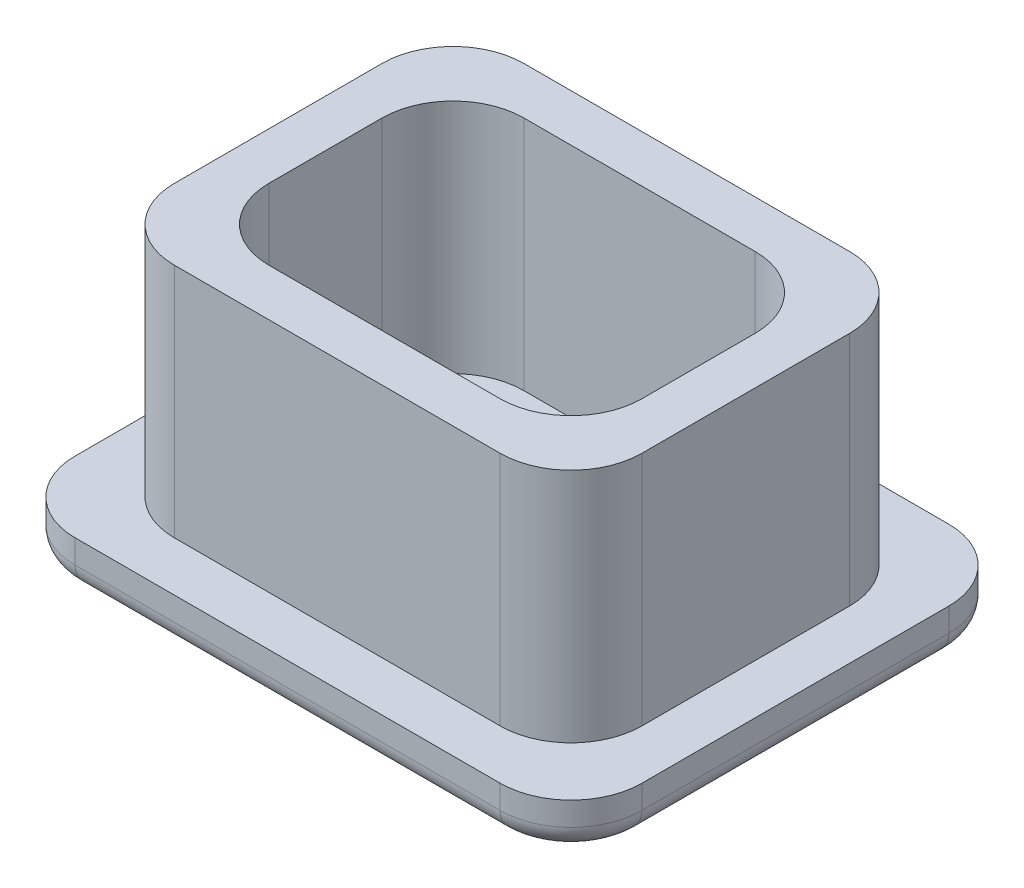
from build123d import *

# Parameters (mm, degrees)
SKETCH1_W           = 24
SKETCH1_H           = 19
BOSS_EXTRUDE1_DEPTH = 2
FILLET1_R           = 3
FILLET2_R           = 1
SKETCH2_W           = 19.8
SKETCH2_H           = 14.8
SKETCH2_W_2         = 15.8
SKETCH2_H_2         = 10.8
BOSS_EXTRUDE2_DEPTH = 10
FILLET3_R           = 3
FILLET4_R           = 3


with BuildPart() as part:
    # Sketch1 → Boss-Extrude1 (new body)
    with BuildSketch(Plane(origin=(0, 0, 0), x_dir=(1, 0, 0), z_dir=(0, 1, 0))):
        with Locations((-26.747676634, 5.960595817)):
            Rectangle(SKETCH1_W, SKETCH1_H)
    extrude(amount=BOSS_EXTRUDE1_DEPTH)

    # Fillet1
    fillet1_edges = [part.edges().sort_by_distance(p)[0] for p in [
        (-38.747676634, 1, -15.460595817),
        (-38.747676634, 1, 3.539404183),
        (-14.747676634, 1, -15.460595817),
        (-14.747676634, 1, 3.539404183),
    ]]
    fillet(fillet1_edges, radius=FILLET1_R)

    # Fillet2
    fillet2_edges = [part.edges().sort_by_distance(p)[0] for p in [
        (-37.868996977, 0, 2.660724527),
        (-38.747676634, 0, -5.960595817),
        (-37.868996977, 0, -14.58191616),
        (-26.747676634, 0, -15.460595817),
        (-15.62635629, 0, -14.58191616),
        (-14.747676634, 0, -5.960595817),
        (-15.62635629, 0, 2.660724527),
        (-26.747676634, 0, 3.539404183),
    ]]
    fillet(fillet2_edges, radius=FILLET2_R)

    # Sketch2 → Boss-Extrude2 (add)
    with BuildSketch(Plane(origin=(0, 2, 0), x_dir=(1, 0, 0), z_dir=(0, 1, 0))):
        with Locations((-26.747676634, 5.960595817)):
            Rectangle(SKETCH2_W, SKETCH2_H)
        with Locations((-26.747676634, 5.960595817)):
            Rectangle(SKETCH2_W_2, SKETCH2_H_2, mode=Mode.SUBTRACT)
    extrude(amount=BOSS_EXTRUDE2_DEPTH)

    # Fillet3
    fillet3_edges = [part.edges().sort_by_distance(p)[0] for p in [
        (-36.647676634, 7, -13.360595817),
        (-36.647676634, 7, 1.439404183),
        (-16.847676634, 7, -13.360595817),
        (-16.847676634, 7, 1.439404183),
    ]]
    fillet(fillet3_edges, radius=FILLET3_R)

    # Fillet4
    fillet4_edges = [part.edges().sort_by_distance(p)[0] for p in [
        (-18.847676634, 7, -11.360595817),
        (-18.847676634, 7, -0.560595817),
        (-34.647676634, 7, -0.560595817),
        (-34.647676634, 7, -11.360595817),
    ]]
    fillet(fillet4_edges, radius=FILLET4_R)


solid = part.part
